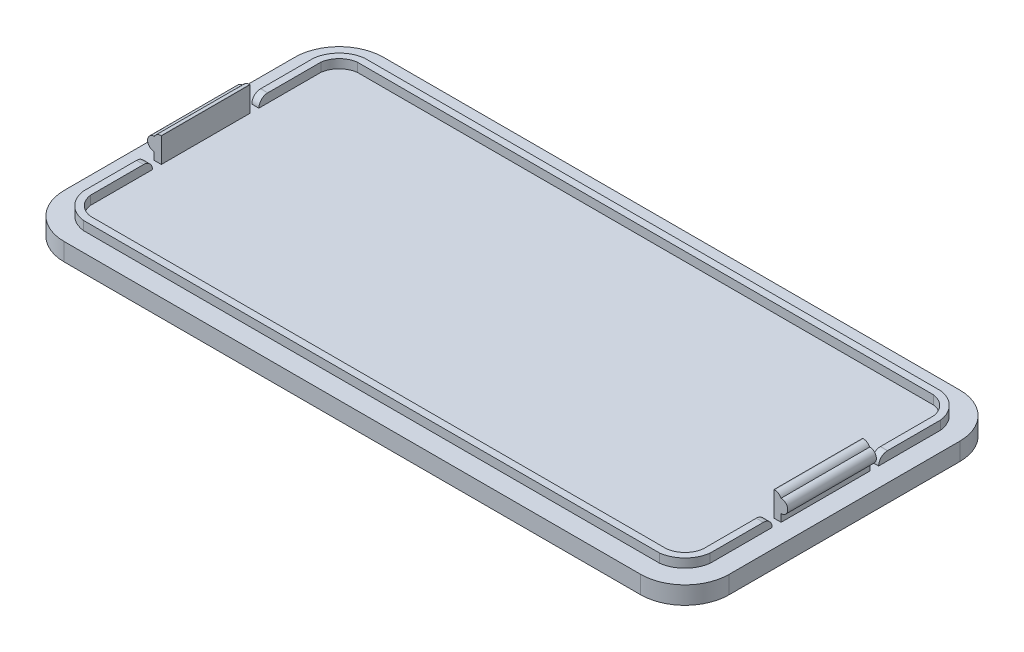
from build123d import *

# Parameters (mm, degrees)
EXTRUDE_2_DEPTH     = 2
EXTRUDE_4_DEPTH     = 1
SKETCH_7_W          = 0.8
SKETCH_7_H          = 10
EXTRUDE_8_DEPTH     = 2.8
SKETCH_8_R          = 0.75
EXTRUDE_9_DEPTH     = 10
FILLET_1_R          = 0.85
SKETCH_11_W         = 1
SKETCH_11_H         = 1
CUT_EXTRUDE_1_DEPTH = 1.2
FILLET_2_R          = 1
SKETCH_12_W         = 0.815007945
SKETCH_12_H         = 4.86663949
CUT_EXTRUDE_2_DEPTH = 0.5
SKETCH_13_W         = 0.8
SKETCH_13_H         = 10
EXTRUDE_10_DEPTH    = 1.8
SKETCH_14_R         = 0.75
EXTRUDE_11_DEPTH    = 10
FILLET_3_R          = 0.85
SKETCH_15_W         = 0.8
SKETCH_15_H         = 1
CUT_EXTRUDE_3_DEPTH = 1
FILLET_4_R          = 1


# Some blends are built 0.0001 mm under size
with BuildPart() as part:
    # case 2 → 凸台-拉伸2 (new body)
    with BuildSketch(Plane(origin=(0, 0, 0), x_dir=(1, 0, 0), z_dir=(0, 1, 0))):
        with BuildLine():
            Line((-34.042196447, 18), (30.957803553, 18))
            ThreePointArc((30.957803553, 18), (34.493337459, 16.535533906), (35.957803553, 13))
            Line((35.957803553, 13), (35.957803553, -13))
            ThreePointArc((35.957803553, -13), (34.493337459, -16.535533906), (30.957803553, -18))
            Line((30.957803553, -18), (-34.042196447, -18))
            ThreePointArc((-34.042196447, -18), (-37.577730353, -16.535533906), (-39.042196447, -13))
            Line((-39.042196447, -13), (-39.042196447, 13))
            ThreePointArc((-39.042196447, 13), (-37.577730353, 16.535533906), (-34.042196447, 18))
        make_face()
    extrude(amount=EXTRUDE_2_DEPTH)

    # 草图3 → 凸台-拉伸4 (add)
    with BuildSketch(Plane(origin=(0, 2, 0), x_dir=(1, 0, 0), z_dir=(0, 1, 0))):
        with BuildLine():
            Line((-36.892196447, 13), (-36.892196447, -13))
            ThreePointArc((-36.892196447, -13), (-35.952846076, -14.910649629), (-34.042196447, -15.85))
            Line((-34.042196447, -15.85), (30.957803553, -15.85))
            ThreePointArc((30.957803553, -15.85), (32.868453181, -14.910649629), (33.807803553, -13))
            Line((33.807803553, -13), (33.807803553, 13))
            ThreePointArc((33.807803553, 13), (32.868453181, 14.910649629), (30.957803553, 15.85))
            Line((30.957803553, 15.85), (-34.042196447, 15.85))
            ThreePointArc((-34.042196447, 15.85), (-35.952846076, 14.910649629), (-36.892196447, 13))
        make_face()
        with BuildLine():
            Line((-34.042196447, -15.05), (30.957803553, -15.05))
            ThreePointArc((30.957803553, -15.05), (32.327315928, -14.369512375), (33.007803553, -13))
            Line((33.007803553, -13), (33.007803553, 13))
            ThreePointArc((33.007803553, 13), (32.327315928, 14.369512375), (30.957803553, 15.05))
            Line((30.957803553, 15.05), (-34.042196447, 15.05))
            ThreePointArc((-34.042196447, 15.05), (-35.411708823, 14.369512375), (-36.092196447, 13))
            Line((-36.092196447, 13), (-36.092196447, -13))
            ThreePointArc((-36.092196447, -13), (-35.411708823, -14.369512375), (-34.042196447, -15.05))
        make_face(mode=Mode.SUBTRACT)
    extrude(amount=EXTRUDE_4_DEPTH)

    # 草图7 → 凸台-拉伸8 (add)
    with BuildSketch(Plane(origin=(0, 2, 0), x_dir=(1, 0, 0), z_dir=(0, 1, 0))):
        with Locations((-36.492196447, 0)):
            Rectangle(SKETCH_7_W, SKETCH_7_H)
    extrude(amount=EXTRUDE_8_DEPTH)

    # 草图8 → 凸台-拉伸9 (add)
    with BuildSketch(Plane.XY.offset(5)):
        with Locations((-36.892196447, 3.6)):
            Circle(SKETCH_8_R)
    extrude(amount=-EXTRUDE_9_DEPTH)

    # 圆角1
    # the kernel refuses this fillet: 0.85 mm, written as the material it takes off along each edge
    with BuildSketch(Plane(origin=(-36.892196447, 4.8, 6.875), x_dir=(0, -1, 0), z_dir=(0, 0, -1))) as fillet_1_piece_1:
        with BuildLine():
            CenterArc((0.85, -0.75), FILLET_1_R, 118.072486936, 61.927513064)
            Line((0, -0.75), (-0.017, -0.75))
            Line((-0.017, -0.75), (-0.017, 0))
            Line((-0.017, 0), (0, 0.017))
            ThreePointArc((0, 0.017), (0.225, 0.017), (0.442, 0.015))
            Line((0.442, 0.015), (0.45, 0))
        make_face()
    extrude(amount=13.75, mode=Mode.SUBTRACT)

    # 草图11 → 切除-拉伸1 (cut)
    with BuildSketch(Plane.ZY.offset(36.892196447)):
        with Locations((5.5, 2.5)):
            Rectangle(SKETCH_11_W, SKETCH_11_H)
        with Locations((-5.5, 2.5)):
            Rectangle(SKETCH_11_W, SKETCH_11_H)
    extrude(amount=-CUT_EXTRUDE_1_DEPTH, mode=Mode.SUBTRACT)

    # 圆角2
    fillet_2_edges = [part.edges().sort_by_distance(p)[0] for p in [
        (-36.492196447, 3, 6),
        (-36.492196447, 3, -6),
    ]]
    fillet(fillet_2_edges, radius=FILLET_2_R - 0.0001)  # a hair under: the kernel refuses the full size

    # 草图12 → 切除-拉伸2 (cut)
    # profile 1 of 9: a face of its own
    with BuildSketch(Plane(origin=(0, 0, 0), x_dir=(-1, 0, 0), z_dir=(0, -1, 0))):
        with BuildLine():
            Line((-8.199275743, 5.02603156), (-9.01984878, 5.499029726))
            Line((-9.01984878, 5.499029726), (-13.276727931, 7.955148964))
            Line((-13.276727931, 7.955148964), (-14.097300969, 8.433851351))
            add(Edge.make_bspline(
                [(-14.097300969, 8.433851351), (-14.365190658, 8.581987184), (-14.661462323, 8.661776712), (-14.957803553, 8.661776712)],
                knots=[3, 3, 3, 3, 4, 4, 4, 4], degree=3))
            add(Edge.make_bspline(
                [(-14.957803553, 8.661776712), (-15.254144782, 8.661776712), (-15.550486011, 8.581987184), (-15.818306136, 8.433851351)],
                knots=[4, 4, 4, 4, 5, 5, 5, 5], degree=3))
            Line((-15.818306136, 8.433851351), (-16.638948738, 7.955148964))
            Line((-16.638948738, 7.955148964), (-20.895827889, 5.499029726))
            Line((-20.895827889, 5.499029726), (-21.71647049, 5.02603156))
            add(Edge.make_bspline(
                [(-21.71647049, 5.02603156), (-22.24640652, 4.718316671), (-22.576973074, 4.148451095), (-22.576973074, 3.538690756)],
                knots=[8, 8, 8, 8, 9, 9, 9, 9], degree=3))
            Line((-22.576973074, 3.538690756), (-22.576973074, -3.276914044))
            add(Edge.make_bspline(
                [(-22.576973074, -3.276914044), (-22.576973074, -3.892343823), (-22.24640652, -4.456539959), (-21.71647049, -4.764254848)],
                knots=[10, 10, 10, 10, 11, 11, 11, 11], degree=3))
            Line((-21.71647049, -4.764254848), (-20.895827889, -5.237253014))
            Line((-20.895827889, -5.237253014), (-16.638948738, -7.693372252))
            Line((-16.638948738, -7.693372252), (-15.818306136, -8.172039857))
            add(Edge.make_bspline(
                [(-15.818306136, -8.172039857), (-15.550486011, -8.325914693), (-15.254144782, -8.4), (-14.957803553, -8.4)],
                knots=[14, 14, 14, 14, 15, 15, 15, 15], degree=3))
            add(Edge.make_bspline(
                [(-14.957803553, -8.4), (-14.661462323, -8.4), (-14.365190658, -8.325914693), (-14.097300969, -8.172039857)],
                knots=[15, 15, 15, 15, 16, 16, 16, 16], degree=3))
            Line((-14.097300969, -8.172039857), (-13.276727931, -7.693372252))
            Line((-13.276727931, -7.693372252), (-9.01984878, -5.237253014))
            Line((-9.01984878, -5.237253014), (-8.199275743, -4.764254848))
            add(Edge.make_bspline(
                [(-8.199275743, -4.764254848), (-7.663565929, -4.456539959), (-7.338773159, -3.892343823), (-7.338773159, -3.276914044)],
                knots=[19, 19, 19, 19, 20, 20, 20, 20], degree=3))
            Line((-7.338773159, -3.276914044), (-7.338773159, 3.538690756))
            add(Edge.make_bspline(
                [(-7.338773159, 3.538690756), (-7.338773159, 4.148451095), (-7.663565929, 4.718316671), (-8.199275743, 5.02603156)],
                knots=[21, 21, 21, 21, 22, 22, 22, 22], degree=3))
        make_face()
        with BuildLine():
            Line((-20.622303543, 4.347890134), (-15.356751194, 7.390987609))
            add(Edge.make_bspline(
                [(-15.356751194, 7.390987609), (-15.111678388, 7.533454003), (-14.803928717, 7.533454003), (-14.553221255, 7.390987609)],
                knots=[3, 3, 3, 3, 4, 4, 4, 4], degree=3))
            Line((-14.553221255, 7.390987609), (-9.31619001, 4.342185913))
            add(Edge.make_bspline(
                [(-9.31619001, 4.342185913), (-9.048369885, 4.188345859), (-9.042665664, 3.800841442), (-9.310485789, 3.641262386)],
                knots=[5, 5, 5, 5, 6, 6, 6, 6], degree=3))
            Line((-9.310485789, 3.641262386), (-14.399346419, 0.598199692))
            add(Edge.make_bspline(
                [(-14.399346419, 0.598199692), (-14.741321415, 0.398725872), (-15.168720597, 0.398725872), (-15.510626029, 0.598199692)],
                knots=[7, 7, 7, 7, 8, 8, 8, 8], degree=3))
            add(Edge.make_bspline(
                [(-15.510626029, 0.598199692), (-20.662163525, 3.572881299), (-20.673571967, 3.57858552)],
                knots=[0, 0, 0, 1, 1, 1], degree=2))
            add(Edge.make_bspline(
                [(-20.673571967, 3.57858552), (-20.941392092, 3.772320338), (-20.912940551, 4.182641639), (-20.622303543, 4.347890134)],
                knots=[1, 1, 1, 1, 2, 2, 2, 2], degree=3))
        make_face(mode=Mode.SUBTRACT)
        with BuildLine():
            Line((-12.820807646, -4.559111588), (-13.413490104, -4.889608579))
            Line((-13.413490104, -4.889608579), (-13.413490104, -3.806884855))
            Line((-13.413490104, -3.806884855), (-12.889258296, -3.544734169))
            add(Edge.make_bspline(
                [(-11.931853522, -2.159964996), (-11.931853522, -2.701344248), (-12.239533629, -3.180011854), (-12.889258296, -3.544734169)],
                knots=[0, 0, 0, 0, 1, 1, 1, 1], degree=3))
            add(Edge.make_bspline(
                [(-12.923414057, -1.971899617), (-12.285167396, -1.607212083), (-11.931853522, -1.601507862), (-11.931853522, -2.159964996)],
                knots=[6, 6, 6, 6, 7, 7, 7, 7], degree=3))
            Line((-12.923414057, -1.971899617), (-13.413490104, -2.245458745))
            add(Edge.make_bspline(
                [(-13.470532313, -2.342326153), (-13.470532313, -2.302431389), (-13.44771543, -2.262536625), (-13.413490104, -2.245458745)],
                knots=[4, 4, 4, 4, 5, 5, 5, 5], degree=3))
            Line((-13.470532313, -2.342326153), (-13.470532313, -3.687200563))
            Line((-13.470532313, -3.687200563), (-13.470532313, -4.98651077))
            Line((-13.470532313, -4.98651077), (-13.470532313, -6.696107495))
            add(Edge.make_bspline(
                [(-13.470532313, -6.696107495), (-13.470532313, -6.736002259), (-13.487575412, -6.770192803), (-13.527435394, -6.792974904)],
                knots=[3, 3, 3, 3, 4, 4, 4, 4], degree=3))
            Line((-13.527435394, -6.792974904), (-14.633010783, -7.419813124))
            add(Edge.make_bspline(
                [(-14.633010783, -7.419813124), (-14.70709609, -7.459707888), (-14.79829406, -7.408439464), (-14.79829406, -7.322945715)],
                knots=[5, 5, 5, 5, 6, 6, 6, 6], degree=3))
            Line((-14.79829406, -7.322945715), (-14.79829406, -2.045984924))
            add(Edge.make_bspline(
                [(-14.79829406, -2.045984924), (-14.79829406, -2.00609016), (-14.781181398, -1.966195396), (-14.741321415, -1.949117515)],
                knots=[7, 7, 7, 7, 8, 8, 8, 8], degree=3))
            Line((-14.741321415, -1.949117515), (-12.860737192, -0.883471672))
            add(Edge.make_bspline(
                [(-12.860737192, -0.883471672), (-11.641216513, -0.193921805), (-10.632612879, -0.057159632), (-10.632612879, -1.424850925)],
                knots=[9, 9, 9, 9, 10, 10, 10, 10], degree=3))
            add(Edge.make_bspline(
                [(-10.632612879, -1.424850925), (-10.632612879, -2.741239012), (-11.652624955, -3.898048043), (-12.820807646, -4.559111588)],
                knots=[10, 10, 10, 10, 11, 11, 11, 11], degree=3))
        make_face(mode=Mode.SUBTRACT)
        with BuildLine():
            Line((-8.917311932, -4.205797714), (-10.011409316, -4.826931714))
            add(Edge.make_bspline(
                [(-10.011409316, -4.826931714), (-10.085494623, -4.866826478), (-10.176692593, -4.815523272), (-10.176692593, -4.730064305)],
                knots=[2, 2, 2, 2, 3, 3, 3, 3], degree=3))
            Line((-10.176692593, -4.730064305), (-10.176692593, -2.21693764))
            add(Edge.make_bspline(
                [(-10.176692593, -2.21693764), (-10.176692593, -2.177077658), (-10.15387571, -2.142852333), (-10.119650385, -2.120070231)],
                knots=[4, 4, 4, 4, 5, 5, 5, 5], degree=3))
            Line((-10.119650385, -2.120070231), (-9.025553001, -1.504605671))
            add(Edge.make_bspline(
                [(-9.025553001, -1.504605671), (-8.951467694, -1.464745689), (-8.860269724, -1.516014113), (-8.860269724, -1.601507862)],
                knots=[6, 6, 6, 6, 7, 7, 7, 7], degree=3))
            Line((-8.860269724, -1.601507862), (-8.860269724, -4.108895524))
            add(Edge.make_bspline(
                [(-8.860269724, -4.108895524), (-8.860269724, -4.148790288), (-8.883086607, -4.188685052), (-8.917311932, -4.205797714)],
                knots=[0, 0, 0, 0, 1, 1, 1, 1], degree=3))
        make_face(mode=Mode.SUBTRACT)
        with BuildLine():
            add(Edge.make_bspline(
                [(-9.515629048, 0.16509629), (-9.076821425, 0.415838534), (-8.763437097, 0.307562684), (-8.763437097, -0.091350175), (-8.763437097, -0.484558813), (-9.076821425, -0.946148538), (-9.515629048, -1.191186561)],
                knots=[2, 2, 2, 2, 3, 3, 3, 4, 4, 4, 4], degree=3))
            add(Edge.make_bspline(
                [(-9.515629048, -1.191186561), (-9.960071328, -1.447633027), (-10.27352522, -1.339357176), (-10.27352522, -0.946148538), (-10.27352522, -0.541531458), (-9.960071328, -0.085645954), (-9.515629048, 0.16509629)],
                knots=[0, 0, 0, 0, 1, 1, 1, 2, 2, 2, 2], degree=3))
        make_face(mode=Mode.SUBTRACT)
    # profile 2 of 9: a face of its own
    with BuildSketch(Plane(origin=(0, 0, 0), x_dir=(-1, 0, 0), z_dir=(0, -1, 0))):
        with BuildLine():
            Line((-3.344009912, 3.059988369), (-5.218889915, 3.059988369))
            Line((-5.218889915, 3.059988369), (-5.218889915, -3.504839405))
            Line((-5.218889915, -3.504839405), (-4.386838872, -3.504839405))
            Line((-4.386838872, -3.504839405), (-4.386838872, -0.900549553))
            Line((-4.386838872, -0.900549553), (-3.298376145, -0.900549553))
            add(Edge.make_bspline(
                [(-3.298376145, -0.900549553), (-1.868007986, -0.900549553), (-0.882151672, -0.250929231), (-0.882151672, 1.133874724)],
                knots=[5, 5, 5, 5, 6, 6, 6, 6], degree=3))
            add(Edge.make_bspline(
                [(-0.882151672, 1.133874724), (-0.882151672, 2.569912322), (-1.868007986, 3.059988369), (-3.344009912, 3.059988369)],
                knots=[6, 6, 6, 6, 7, 7, 7, 7], degree=3))
        make_face()
        with BuildLine():
            Line((-3.406617214, -0.228112348), (-4.386838872, -0.228112348))
            Line((-4.386838872, -0.228112348), (-4.386838872, 2.387551164))
            Line((-4.386838872, 2.387551164), (-3.440842539, 2.387551164))
            add(Edge.make_bspline(
                [(-3.440842539, 2.387551164), (-2.289702947, 2.387551164), (-1.70842893, 2.085540496), (-1.70842893, 1.133874724)],
                knots=[3, 3, 3, 3, 4, 4, 4, 4], degree=3))
            add(Edge.make_bspline(
                [(-1.70842893, 1.133874724), (-1.70842893, 0.193582612), (-2.249842965, -0.228112348), (-3.406617214, -0.228112348)],
                knots=[4, 4, 4, 4, 5, 5, 5, 5], degree=3))
        make_face(mode=Mode.SUBTRACT)
    # profile 3 of 9: a face of its own
    with BuildSketch(Plane(origin=(0, 0, 0), x_dir=(-1, 0, 0), z_dir=(0, -1, 0))):
        with Locations((0.602337022, -1.07151966)):
            Rectangle(SKETCH_12_W, SKETCH_12_H)
    # profile 4 of 9: a face of its own
    with BuildSketch(Plane(origin=(0, 0, 0), x_dir=(-1, 0, 0), z_dir=(0, -1, 0))):
        with BuildLine():
            Line((5.716866646, 0.2847458), (4.884885167, 0.615277573))
            add(Edge.make_bspline(
                [(4.884885167, 0.615277573), (4.297906929, 0.848941937), (3.876211968, 0.99140833), (3.876211968, 1.361800085)],
                knots=[1, 1, 1, 1, 2, 2, 2, 2], degree=3))
            add(Edge.make_bspline(
                [(3.876211968, 1.361800085), (3.876211968, 1.715113959), (4.178257418, 1.91458778), (4.674037686, 1.91458778)],
                knots=[2, 2, 2, 2, 3, 3, 3, 3], degree=3))
            add(Edge.make_bspline(
                [(4.674037686, 1.91458778), (5.192565274, 1.91458778), (5.602921356, 1.737930843), (6.041659416, 1.401694849)],
                knots=[3, 3, 3, 3, 4, 4, 4, 4], degree=3))
            Line((6.041659416, 1.401694849), (6.839554697, 2.404663827))
            add(Edge.make_bspline(
                [(6.839554697, 2.404663827), (6.25828068, 2.991607282), (5.4433423, 3.287948512), (4.674037686, 3.287948512)],
                knots=[5, 5, 5, 5, 6, 6, 6, 6], degree=3))
            add(Edge.make_bspline(
                [(4.674037686, 3.287948512), (3.255077969, 3.287948512), (2.252108992, 2.387551164), (2.252108992, 1.270636897)],
                knots=[6, 6, 6, 6, 7, 7, 7, 7], degree=3))
            add(Edge.make_bspline(
                [(2.252108992, 1.270636897), (2.252108992, 0.301858463), (2.907398752, -0.279415554), (3.608391843, -0.558644121)],
                knots=[7, 7, 7, 7, 8, 8, 8, 8], degree=3))
            Line((3.608391843, -0.558644121), (4.457485985, -0.917662216))
            add(Edge.make_bspline(
                [(4.457485985, -0.917662216), (5.02735156, -1.156996018), (5.397778097, -1.282384531), (5.397778097, -1.669888949)],
                knots=[9, 9, 9, 9, 10, 10, 10, 10], degree=3))
            add(Edge.make_bspline(
                [(5.397778097, -1.669888949), (5.397778097, -2.028907043), (5.11854953, -2.251128184), (4.525867072, -2.251128184)],
                knots=[10, 10, 10, 10, 11, 11, 11, 11], degree=3))
            add(Edge.make_bspline(
                [(4.525867072, -2.251128184), (4.001635263, -2.251128184), (3.3804317, -1.971899617), (2.907398752, -1.567317319)],
                knots=[11, 11, 11, 11, 12, 12, 12, 12], degree=3))
            Line((2.907398752, -1.567317319), (2.001401529, -2.672857926))
            add(Edge.make_bspline(
                [(2.001401529, -2.672857926), (2.690916615, -3.305400367), (3.625434942, -3.630227918), (4.491641747, -3.630227918)],
                knots=[13, 13, 13, 13, 14, 14, 14, 14], degree=3))
            add(Edge.make_bspline(
                [(4.491641747, -3.630227918), (6.104405845, -3.630227918), (7.038924172, -2.655745263), (7.038924172, -1.544500435)],
                knots=[14, 14, 14, 14, 15, 15, 15, 15], degree=3))
            add(Edge.make_bspline(
                [(7.038924172, -1.544500435), (7.038924172, -0.604243106), (6.543213468, -0.04575119), (5.716866646, 0.2847458)],
                knots=[15, 15, 15, 15, 16, 16, 16, 16], degree=3))
        make_face()
    # profile 5 of 9: a face of its own
    with BuildSketch(Plane(origin=(0, 0, 0), x_dir=(-1, 0, 0), z_dir=(0, -1, 0))):
        with BuildLine():
            Line((10.822909503, 1.589760228), (10.822909503, -1.749678477))
            add(Edge.make_bspline(
                [(10.822909503, -1.749678477), (10.555089378, -2.125774452), (10.332763892, -2.268240846), (9.973815361, -2.268240846)],
                knots=[1, 1, 1, 1, 2, 2, 2, 2], degree=3))
            add(Edge.make_bspline(
                [(9.973815361, -2.268240846), (9.569163499, -2.268240846), (9.381132902, -2.068801808), (9.381132902, -1.362139278)],
                knots=[2, 2, 2, 2, 3, 3, 3, 3], degree=3))
            Line((9.381132902, -1.362139278), (9.381132902, 1.589760228))
            Line((9.381132902, 1.589760228), (7.791185687, 1.589760228))
            Line((7.791185687, 1.589760228), (7.791185687, -1.561613098))
            add(Edge.make_bspline(
                [(7.791185687, -1.561613098), (7.791185687, -2.8324022), (8.264218635, -3.630227918), (9.375428681, -3.630227918)],
                knots=[6, 6, 6, 6, 7, 7, 7, 7], degree=3))
            add(Edge.make_bspline(
                [(9.375428681, -3.630227918), (10.070647988, -3.630227918), (10.549385157, -3.305400367), (10.971080117, -2.803915878)],
                knots=[7, 7, 7, 7, 8, 8, 8, 8], degree=3))
            Line((10.971080117, -2.803915878), (11.005235879, -2.803915878))
            Line((11.005235879, -2.803915878), (11.119250732, -3.504839405))
            Line((11.119250732, -3.504839405), (12.418491375, -3.504839405))
            Line((12.418491375, -3.504839405), (12.418491375, 1.589760228))
            Line((12.418491375, 1.589760228), (10.822909503, 1.589760228))
        make_face()
    # profile 6 of 9: a face of its own
    with BuildSketch(Plane(origin=(0, 0, 0), x_dir=(-1, 0, 0), z_dir=(0, -1, 0))):
        with BuildLine():
            Line((16.270788228, -2.501870428), (15.467258289, -2.501870428))
            add(Edge.make_bspline(
                [(15.467258289, -2.501870428), (14.920209598, -2.501870428), (14.715066338, -2.393594577), (14.715066338, -2.159964996)],
                knots=[1, 1, 1, 1, 2, 2, 2, 2], degree=3))
            add(Edge.make_bspline(
                [(14.715066338, -2.159964996), (14.715066338, -1.989012279), (14.75492632, -1.909222751), (14.874575831, -1.800946901)],
                knots=[2, 2, 2, 2, 3, 3, 3, 3], degree=3))
            add(Edge.make_bspline(
                [(14.874575831, -1.800946901), (15.096901316, -1.863623766), (15.301975012, -1.892144871), (15.47296251, -1.892144871)],
                knots=[3, 3, 3, 3, 4, 4, 4, 4], degree=3))
            add(Edge.make_bspline(
                [(15.47296251, -1.892144871), (16.601285219, -1.892144871), (17.507421569, -1.373547719), (17.507421569, -0.182548145)],
                knots=[4, 4, 4, 4, 5, 5, 5, 5], degree=3))
            add(Edge.make_bspline(
                [(17.507421569, -0.182548145), (17.507421569, 0.06252466), (17.44467514, 0.296154242), (17.364955175, 0.438620636)],
                knots=[5, 5, 5, 5, 6, 6, 6, 6], degree=3))
            Line((17.364955175, 0.438620636), (18.151302888, 0.438620636))
            Line((18.151302888, 0.438620636), (18.151302888, 1.589760228))
            Line((18.151302888, 1.589760228), (16.28219667, 1.589760228))
            add(Edge.make_bspline(
                [(16.28219667, 1.589760228), (16.048532306, 1.675219195), (15.769303739, 1.715113959), (15.47296251, 1.715113959)],
                knots=[9, 9, 9, 9, 10, 10, 10, 10], degree=3))
            add(Edge.make_bspline(
                [(15.47296251, 1.715113959), (14.373160906, 1.715113959), (13.341670824, 1.111057841), (13.341670824, -0.13694916)],
                knots=[10, 10, 10, 10, 11, 11, 11, 11], degree=3))
            add(Edge.make_bspline(
                [(13.341670824, -0.13694916), (13.341670824, -0.729596837), (13.672237378, -1.202595003), (14.03118591, -1.453337247)],
                knots=[11, 11, 11, 11, 12, 12, 12, 12], degree=3))
            Line((14.03118591, -1.453337247), (14.03118591, -1.487527791))
            add(Edge.make_bspline(
                [(14.03118591, -1.487527791), (13.700688919, -1.721157372), (13.467024555, -2.080175467), (13.467024555, -2.439193562)],
                knots=[13, 13, 13, 13, 14, 14, 14, 14], degree=3))
            add(Edge.make_bspline(
                [(13.467024555, -2.439193562), (13.467024555, -2.866592744), (13.666533158, -3.134447651), (13.934353283, -3.316808808)],
                knots=[14, 14, 14, 14, 15, 15, 15, 15], degree=3))
            Line((13.934353283, -3.316808808), (13.934353283, -3.362373012))
            add(Edge.make_bspline(
                [(13.934353283, -3.362373012), (13.461320335, -3.601741596), (13.210612872, -3.943647028), (13.210612872, -4.365341989)],
                knots=[16, 16, 16, 16, 17, 17, 17, 17], degree=3))
            add(Edge.make_bspline(
                [(13.210612872, -4.365341989), (13.210612872, -5.277112996), (14.173652304, -5.647539533), (15.347608779, -5.647539533)],
                knots=[17, 17, 17, 17, 18, 18, 18, 18], degree=3))
            add(Edge.make_bspline(
                [(15.347608779, -5.647539533), (17.11988237, -5.647539533), (18.23116198, -4.88393914), (18.23116198, -3.806884855)],
                knots=[18, 18, 18, 18, 19, 19, 19, 19], degree=3))
            add(Edge.make_bspline(
                [(18.23116198, -3.806884855), (18.23116198, -2.883705406), (17.524534232, -2.501870428), (16.270788228, -2.501870428)],
                knots=[19, 19, 19, 19, 20, 20, 20, 20], degree=3))
        make_face()
        with BuildLine():
            Line((15.484370952, -3.721391106), (15.968812342, -3.721391106))
            add(Edge.make_bspline(
                [(15.968812342, -3.721391106), (16.441706162, -3.721391106), (16.709595851, -3.784067972), (16.709595851, -4.086113422)],
                knots=[4, 4, 4, 4, 5, 5, 5, 5], degree=3))
            add(Edge.make_bspline(
                [(16.709595851, -4.086113422), (16.709595851, -4.410940974), (16.253745129, -4.650274776), (15.598316241, -4.650274776)],
                knots=[5, 5, 5, 5, 6, 6, 6, 6], degree=3))
            add(Edge.make_bspline(
                [(15.598316241, -4.650274776), (14.943026481, -4.650274776), (14.5156273, -4.473617839), (14.5156273, -4.114599745)],
                knots=[0, 0, 0, 0, 1, 1, 1, 1], degree=3))
            add(Edge.make_bspline(
                [(14.5156273, -4.114599745), (14.5156273, -3.943647028), (14.595347264, -3.801180635), (14.75492632, -3.658714241)],
                knots=[1, 1, 1, 1, 2, 2, 2, 2], degree=3))
            add(Edge.make_bspline(
                [(14.75492632, -3.658714241), (14.920209598, -3.704313226), (15.114013979, -3.721391106), (15.484370952, -3.721391106)],
                knots=[2, 2, 2, 2, 3, 3, 3, 3], degree=3))
        make_face(mode=Mode.SUBTRACT)
        with BuildLine():
            add(Edge.make_bspline(
                [(15.47296251, -0.934740096), (15.108309758, -0.934740096), (14.829081191, -0.666919971), (14.829081191, -0.13694916), (14.829081191, 0.381647991), (15.108309758, 0.649468116), (15.47296251, 0.649468116)],
                knots=[2, 2, 2, 2, 3, 3, 3, 4, 4, 4, 4], degree=3))
            add(Edge.make_bspline(
                [(15.47296251, 0.649468116), (15.849093268, 0.649468116), (16.116913393, 0.381647991), (16.116913393, -0.13694916), (16.116913393, -0.666919971), (15.849093268, -0.934740096), (15.47296251, -0.934740096)],
                knots=[0, 0, 0, 0, 1, 1, 1, 2, 2, 2, 2], degree=3))
        make_face(mode=Mode.SUBTRACT)
    # profile 7 of 9: a face of its own
    with BuildSketch(Plane(origin=(0, 0, 0), x_dir=(-1, 0, 0), z_dir=(0, -1, 0))):
        with BuildLine():
            Line((18.607223174, 1.048380975), (19.165680307, -0.000186987))
            add(Edge.make_bspline(
                [(19.165680307, -0.000186987), (19.67293858, 0.2847458), (20.094633541, 0.444324857), (20.499215839, 0.444324857)],
                knots=[2, 2, 2, 2, 3, 3, 3, 3], degree=3))
            add(Edge.make_bspline(
                [(20.499215839, 0.444324857), (21.017743426, 0.444324857), (21.234364691, 0.204991054), (21.268520453, -0.205330247)],
                knots=[3, 3, 3, 3, 4, 4, 4, 4], degree=3))
            add(Edge.make_bspline(
                [(21.268520453, -0.205330247), (19.27969516, -0.421881948), (18.436235676, -1.003121183), (18.436235676, -2.080175467)],
                knots=[4, 4, 4, 4, 5, 5, 5, 5], degree=3))
            add(Edge.make_bspline(
                [(18.436235676, -2.080175467), (18.436235676, -2.929269609), (19.011805472, -3.630227918), (19.952167147, -3.630227918)],
                knots=[5, 5, 5, 5, 6, 6, 6, 6], degree=3))
            add(Edge.make_bspline(
                [(19.952167147, -3.630227918), (20.516328501, -3.630227918), (20.989291886, -3.368077232), (21.410986846, -2.991981257)],
                knots=[6, 6, 6, 6, 7, 7, 7, 7], degree=3))
            Line((21.410986846, -2.991981257), (21.450846829, -2.991981257))
            Line((21.450846829, -2.991981257), (21.564792118, -3.504839405))
            Line((21.564792118, -3.504839405), (22.864102325, -3.504839405))
            Line((22.864102325, -3.504839405), (22.864102325, -0.609947326))
            add(Edge.make_bspline(
                [(22.864102325, -0.609947326), (22.864102325, 0.98570411), (22.117614594, 1.715113959), (20.801261289, 1.715113959)],
                knots=[11, 11, 11, 11, 12, 12, 12, 12], degree=3))
            add(Edge.make_bspline(
                [(20.801261289, 1.715113959), (20.009070228, 1.715113959), (19.27969516, 1.447293834), (18.607223174, 1.048380975)],
                knots=[0, 0, 0, 0, 1, 1, 1, 1], degree=3))
        make_face()
        with BuildLine():
            Line((21.268520453, -1.174108681), (21.268520453, -1.989012279))
            add(Edge.make_bspline(
                [(21.268520453, -1.989012279), (21.034856089, -2.239754524), (20.824008609, -2.393594577), (20.499215839, -2.393594577)],
                knots=[0, 0, 0, 0, 1, 1, 1, 1], degree=3))
            add(Edge.make_bspline(
                [(20.499215839, -2.393594577), (20.168649284, -2.393594577), (19.952167147, -2.251128184), (19.952167147, -1.954821736)],
                knots=[1, 1, 1, 1, 2, 2, 2, 2], degree=3))
            add(Edge.make_bspline(
                [(19.952167147, -1.954821736), (19.952167147, -1.595803641), (20.276959917, -1.310870854), (21.268520453, -1.174108681)],
                knots=[2, 2, 2, 2, 3, 3, 3, 3], degree=3))
        make_face(mode=Mode.SUBTRACT)
    # profile 8 of 9: a face of its own
    with BuildSketch(Plane(origin=(0, 0, 0), x_dir=(-1, 0, 0), z_dir=(0, -1, 0))):
        with BuildLine():
            Line((25.354481669, 0.706475543), (25.320256344, 0.706475543))
            Line((25.320256344, 0.706475543), (25.212015276, 1.589760228))
            Line((25.212015276, 1.589760228), (23.912705069, 1.589760228))
            Line((23.912705069, 1.589760228), (23.912705069, -3.504839405))
            Line((23.912705069, -3.504839405), (25.496948063, -3.504839405))
            Line((25.496948063, -3.504839405), (25.496948063, -0.592834664))
            add(Edge.make_bspline(
                [(25.496948063, -0.592834664), (25.764768188, 0.079602541), (26.220688474, 0.318936344), (26.596749668, 0.318936344)],
                knots=[7, 7, 7, 7, 8, 8, 8, 8], degree=3))
            add(Edge.make_bspline(
                [(26.596749668, 0.318936344), (26.82470981, 0.318936344), (26.972880425, 0.2847458), (27.155206801, 0.239181597)],
                knots=[8, 8, 8, 8, 9, 9, 9, 9], degree=3))
            Line((27.155206801, 0.239181597), (27.423026926, 1.612542329))
            add(Edge.make_bspline(
                [(27.423026926, 1.612542329), (27.280560532, 1.675219195), (27.109642598, 1.715113959), (26.807597148, 1.715113959)],
                knots=[10, 10, 10, 10, 11, 11, 11, 11], degree=3))
            add(Edge.make_bspline(
                [(26.807597148, 1.715113959), (26.294704217, 1.715113959), (25.730542863, 1.384582187), (25.354481669, 0.706475543)],
                knots=[0, 0, 0, 0, 1, 1, 1, 1], degree=3))
        make_face()
    # profile 9 of 9: a face of its own
    with BuildSketch(Plane(origin=(0, 0, 0), x_dir=(-1, 0, 0), z_dir=(0, -1, 0))):
        with BuildLine():
            add(Edge.make_bspline(
                [(0.605189132, 2.364769063), (0.929981902, 2.364769063), (1.169350486, 2.587024984), (1.169350486, 2.889035653), (1.169350486, 3.225271646), (0.929981902, 3.419006464), (0.605189132, 3.419006464)],
                knots=[2, 2, 2, 2, 3, 3, 3, 4, 4, 4, 4], degree=3))
            add(Edge.make_bspline(
                [(0.605189132, 3.419006464), (0.280396362, 3.419006464), (0.041027778, 3.225271646), (0.041027778, 2.889035653), (0.041027778, 2.587024984), (0.280396362, 2.364769063), (0.605189132, 2.364769063)],
                knots=[0, 0, 0, 0, 1, 1, 1, 2, 2, 2, 2], degree=3))
        make_face()
    extrude(amount=-CUT_EXTRUDE_2_DEPTH, mode=Mode.SUBTRACT)

    # 草图13 → 凸台-拉伸10 (add)
    with BuildSketch(Plane(origin=(0, 3, 0), x_dir=(1, 0, 0), z_dir=(0, 1, 0))):
        with Locations((33.407803553, 0)):
            Rectangle(SKETCH_13_W, SKETCH_13_H)
    extrude(amount=EXTRUDE_10_DEPTH)

    # 草图14 → 凸台-拉伸11 (add)
    with BuildSketch(Plane.XY.offset(5)):
        with Locations((33.807803553, 3.6)):
            Circle(SKETCH_14_R)
    extrude(amount=-EXTRUDE_11_DEPTH)

    # 圆角3
    # the kernel refuses this fillet: 0.85 mm, written as the material it takes off along each edge
    with BuildSketch(Plane(origin=(33.807803553, 4.8, -6.875), x_dir=(0, -1, 0), z_dir=(0, 0, 1))) as fillet_3_piece_1:
        with BuildLine():
            CenterArc((0.85, -0.75), FILLET_3_R, 118.072486936, 61.927513064)
            Line((0, -0.75), (-0.017, -0.75))
            Line((-0.017, -0.75), (-0.017, 0))
            Line((-0.017, 0), (0, 0.017))
            ThreePointArc((0, 0.017), (0.225, 0.017), (0.442, 0.015))
            Line((0.442, 0.015), (0.45, 0))
        make_face()
    extrude(amount=13.75, mode=Mode.SUBTRACT)

    # 草图15 → 切除-拉伸3 (cut)
    with BuildSketch(Plane(origin=(0, 3, 0), x_dir=(1, 0, 0), z_dir=(0, 1, 0))):
        with Locations((33.407803553, 5.5)):
            Rectangle(SKETCH_15_W, SKETCH_15_H)
        with Locations((33.407803553, -5.5)):
            Rectangle(SKETCH_15_W, SKETCH_15_H)
    extrude(amount=-CUT_EXTRUDE_3_DEPTH, mode=Mode.SUBTRACT)

    # 圆角4
    fillet_4_edges = [part.edges().sort_by_distance(p)[0] for p in [
        (33.407803553, 3, 6),
        (33.407803553, 3, -6),
    ]]
    fillet(fillet_4_edges, radius=FILLET_4_R - 0.0001)  # a hair under: the kernel refuses the full size


solid = part.part
